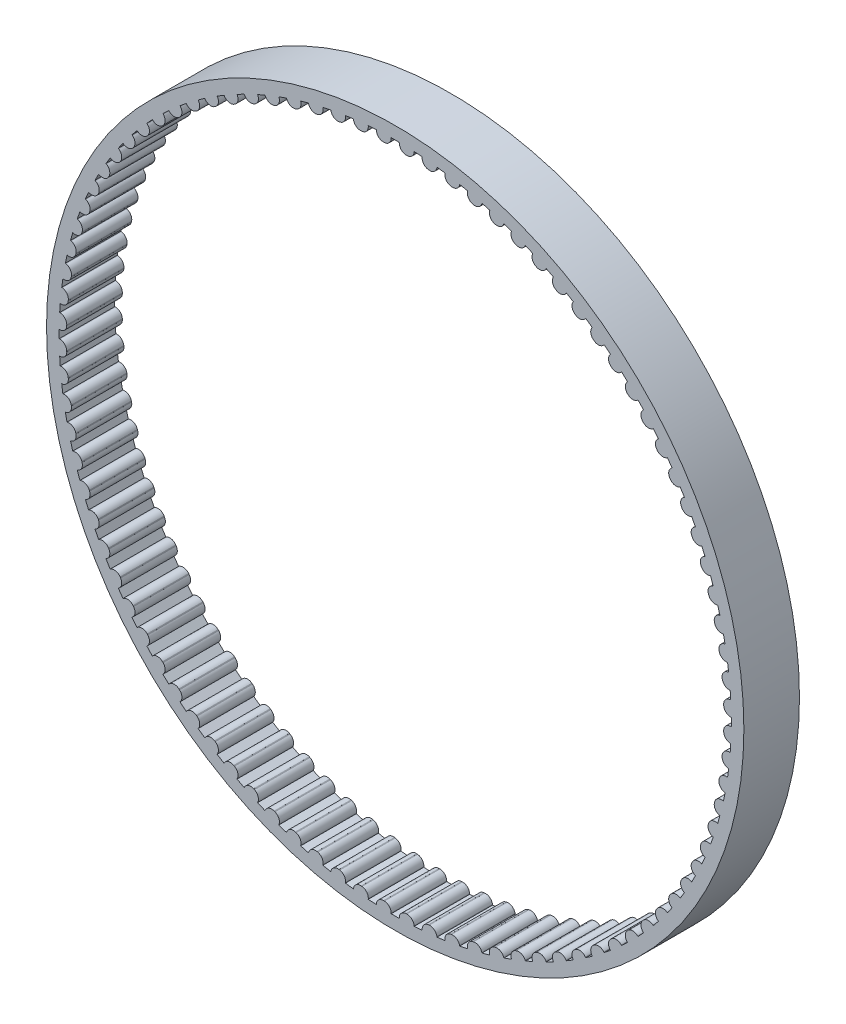
from build123d import *

# Parameters (mm, degrees)
SKETCH1_R           = 34.5
SKETCH1_R_2         = 32.5
BOSS_EXTRUDE3_DEPTH = 5.5
CUT_EXTRUDE1_DEPTH  = 50.099388998
CIRPATTERN1_COUNT   = 92


with BuildPart() as part:
    # Sketch1 → Boss-Extrude3 (new body)
    with BuildSketch(Plane.XY):
        Circle(SKETCH1_R)
        Circle(SKETCH1_R_2, mode=Mode.SUBTRACT)
    extrude(amount=BOSS_EXTRUDE3_DEPTH)

    # Sketch4 → Cut-Extrude1 (cut, through all)
    with BuildSketch(Plane.XY.offset(5.5)):
        with BuildLine():
            Line((-0.4, 33.199839674), (-0.4, 33.25))
            Line((-0.4, 33.25), (0.4, 33.25))
            Line((0.4, 33.25), (0.4, 33.199839674))
            ThreePointArc((0.4, 33.199839674), (0.605838218, 32.704053296), (1.102297523, 32.499843445))
            Line((1.102297523, 32.499843445), (1.14999596, 32.5))
            Line((1.14999596, 32.5), (1.14999596, 32))
            Line((1.14999596, 32), (-1.14999596, 32))
            Line((-1.14999596, 32), (-1.14999596, 32.5))
            Line((-1.14999596, 32.5), (-1.102297523, 32.499843445))
            ThreePointArc((-1.102297523, 32.499843445), (-0.605838218, 32.704053296), (-0.4, 33.199839674))
        make_face()
    cut_extrude1 = extrude(amount=-CUT_EXTRUDE1_DEPTH, mode=Mode.SUBTRACT)

    # CirPattern1: Cut-Extrude1 ×92 about axis
    cirpattern1_axis = Axis((0, 0, 5.5), (0, 0, -1))
    for i in range(1, CIRPATTERN1_COUNT):
        add(cut_extrude1.rotate(cirpattern1_axis, i * 360 / CIRPATTERN1_COUNT), mode=Mode.SUBTRACT)


solid = part.part
